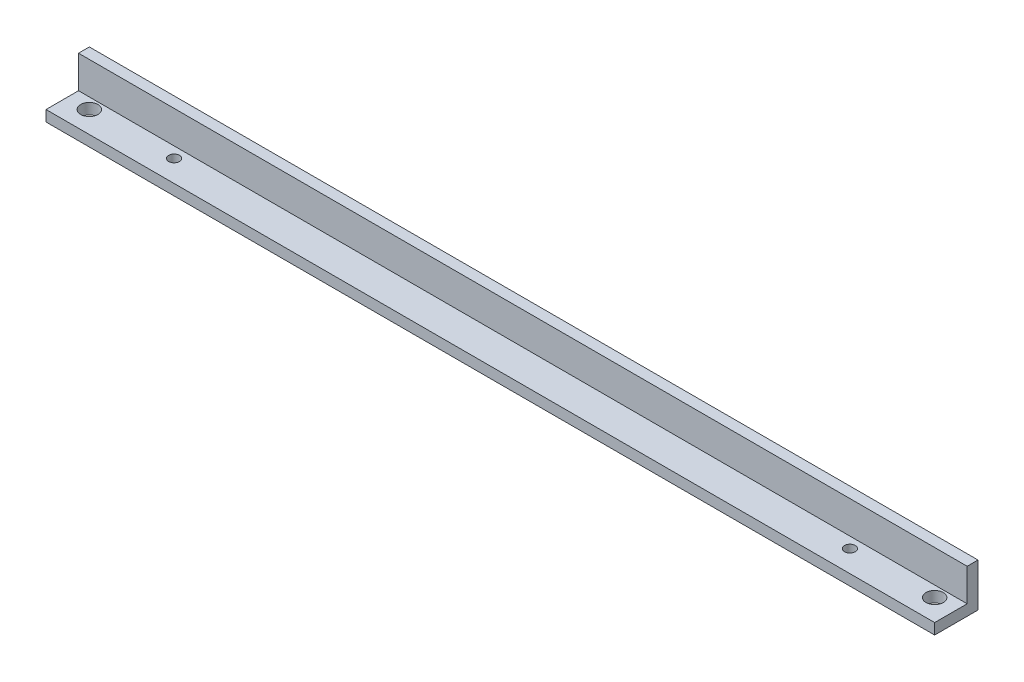
from build123d import *

# Parameters (mm, degrees)
BOSS_EXTRUDE1_DEPTH = 520.7
SKETCH2_R           = 5.08
SKETCH2_R_2         = 3.175
CUT_EXTRUDE1_DEPTH  = 914.4


with BuildPart() as part:
    # Sketch1 → Boss-Extrude1 (new body)
    with BuildSketch(Plane(origin=(0, 0, 0), x_dir=(0, 0, -1), z_dir=(1, 0, 0))):
        Polygon((0, 0), (0, 19.05), (6.35, 19.05), (6.35, -6.35), (-19.05, -6.35), (-19.05, 0), align=None)
    extrude(amount=BOSS_EXTRUDE1_DEPTH)

    # Sketch2 → Cut-Extrude1 (cut)
    with BuildSketch(Plane.XZ.offset(6.35)):
        with Locations((12.7, 6.35)):
            Circle(SKETCH2_R)
        with Locations((62.357, 6.35)):
            Circle(SKETCH2_R_2)
        with Locations((458.343, 6.35)):
            Circle(SKETCH2_R_2)
        with Locations((508, 6.35)):
            Circle(SKETCH2_R)
    extrude(amount=-CUT_EXTRUDE1_DEPTH, mode=Mode.SUBTRACT)


solid = part.part
